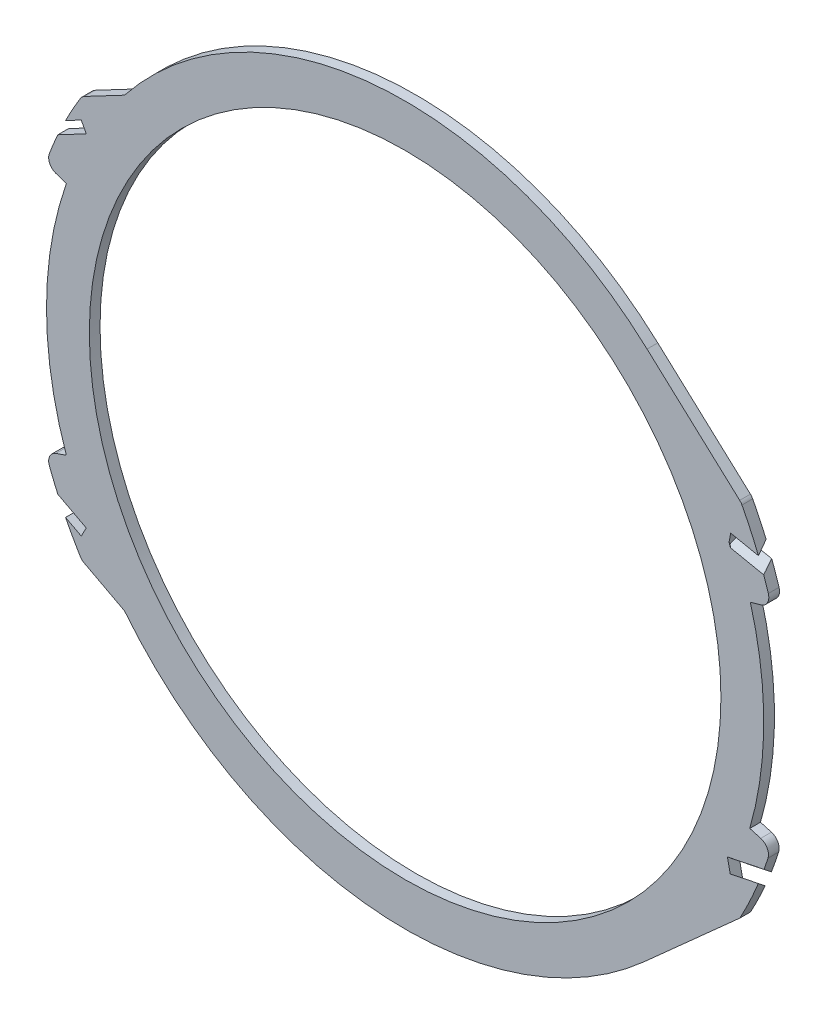
from build123d import *

# Parameters (mm, degrees)
SKETCH1_R            = 335
SKETCH1_R_2          = 295
BOSS_EXTRUDE1_DEPTH  = 10
BOSS_EXTRUDE2_DEPTH  = 10
BOSS_EXTRUDE3_DEPTH  = 10
CUT_EXTRUDE1_DEPTH   = 10
CUT_EXTRUDE2_START   = 272.424930167
CUT_EXTRUDE2_DEPTH   = 38.548591659
CUT_EXTRUDE2_START_2 = 161.824552733
CUT_EXTRUDE2_2_DEPTH = 10
BOSS_EXTRUDE4_DEPTH  = 10


with BuildPart() as part:
    # Sketch1 → Boss-Extrude1 (new body)
    with BuildSketch(Plane.XY):
        Circle(SKETCH1_R)
        Circle(SKETCH1_R_2, mode=Mode.SUBTRACT)
    extrude(amount=BOSS_EXTRUDE1_DEPTH)

    # Sketch2 → Boss-Extrude2 (add)
    with BuildSketch(Plane(origin=(0, 0, 0), x_dir=(-1, 0, 0), z_dir=(0, 0, -1))):
        with BuildLine():
            ThreePointArc((-322.474278085, 90.748773952), (-285.195118694, 175.7519396), (-226.022138309, 247.263003691))
            Line((-226.022138309, 247.263003691), (-312.556910604, 168.161908985))
            ThreePointArc((-312.556910604, 168.161908985), (-313.727388299, 166.889496734), (-314.661210657, 165.434496124))
            ThreePointArc((-314.661210657, 165.434496124), (-328.310849458, 136.353350264), (-339.27949001, 106.158738023))
            ThreePointArc((-339.27949001, 106.158738023), (-338.523562212, 98.412053492), (-332.442347906, 93.553928275))
            Line((-332.442347906, 93.553928275), (-322.474278085, 90.748773952))
        make_face()
    extrude(amount=-BOSS_EXTRUDE2_DEPTH)

    # Sketch3 → Boss-Extrude3 (add)
    with BuildSketch(Plane(origin=(0, 0, 0), x_dir=(-1, 0, 0), z_dir=(0, 0, -1))):
        with BuildLine():
            Line((-289.450839465, -149.430532958), (-290.086949825, -136.323752762))
            Line((-290.086949825, -136.323752762), (-321.966145398, -92.535405211))
            Line((-321.966145398, -92.535405211), (-332.178557921, -95.470526635))
            ThreePointArc((-332.178557921, -95.470526635), (-338.234587628, -100.365745681), (-338.943329669, -108.120508737))
            ThreePointArc((-338.943329669, -108.120508737), (-327.253686464, -139.562351058), (-312.654741, -169.763476834))
            Line((-312.654741, -169.763476834), (-223.394344885, -249.639673677))
            Line((-223.394344885, -249.639673677), (-289.450839465, -149.430532958))
        make_face()
    extrude(amount=-BOSS_EXTRUDE3_DEPTH)

    # Sketch4 → Cut-Extrude1 (cut)
    with BuildSketch(Plane(origin=(23.906119202, -116.35832345, 93.20136559), x_dir=(0.9873859847265816, 0.12357681316719145, -0.0989832733999036), z_dir=(-0.15833166823323438, 0.7706481888305408, -0.6172782613106412))):
        Polygon((282.331330651, 83.607742228), (286.950805192, 120.032776555), (337.459038649, 113.627250716), (329.847523561, 53.609667359), (279.339290104, 60.015193198), align=None)
    extrude(amount=-CUT_EXTRUDE1_DEPTH, mode=Mode.SUBTRACT)

    # Cut-Extrude2: read off the stored shape, not the designer's step
    # Cut-Extrude2 outline → Cut-Extrude2 (cut)
    with BuildSketch(Plane(origin=(0, 0, 0), x_dir=(0.20124905404319107, 0.9795401054815064, 0), z_dir=(0.9795401054815065, -0.20124905404319107, 0)).offset(CUT_EXTRUDE2_START)):
        Polygon((202.006915017, 0), (195.824910476, 10), (184.068330185, 10), (190.250334726, 0), align=None)
    extrude(amount=CUT_EXTRUDE2_DEPTH, mode=Mode.SUBTRACT)

    # Cut-Extrude2 2 outline → Cut-Extrude2 2 (cut)
    with BuildSketch(Plane(origin=(0, 0, 0), x_dir=(0.9852397845422891, -0.14476117541924635, -0.09136065370990885), z_dir=(0.1711799256778192, 0.8331845496216821, 0.5258335661753164)).offset(CUT_EXTRUDE2_START_2)):
        with BuildLine():
            Line((280.153711914, 76.574004203), (278.423879054, 60.562054707))
            add(Edge.make_bspline(
                [(278.423879054, 60.562054707), (279.04318666, 59.849827211), (279.679221342, 59.165584066), (280.331358402, 58.511847756)],
                knots=[0.202262646, 0.202262646, 0.202262646, 0.202262646, 0.204525626, 0.204525626, 0.204525626, 0.204525626], degree=3))
            Line((280.331358402, 58.511847756), (282.258121917, 76.346656647))
            Line((282.258121917, 76.346656647), (282.436738997, 78))
            Line((282.436738997, 78), (280.307767758, 78))
            Line((280.307767758, 78), (280.153711914, 76.574004203))
        make_face()
    extrude(amount=CUT_EXTRUDE2_2_DEPTH, mode=Mode.SUBTRACT)

    # Sketch6 → Boss-Extrude4 (add)
    with BuildSketch(Plane(origin=(0, 0, 0), x_dir=(-1, 0, 0), z_dir=(0, 0, -1))):
        with BuildLine():
            Line((297.863422842, -159.420809844), (324.396421164, -145.420809844))
            ThreePointArc((324.396421164, -145.420809844), (328.498305309, -135.901116291), (332.320896217, -126.265877963))
            ThreePointArc((332.320896217, -126.265877963), (332.034149526, -118.483971626), (326.252641154, -113.267224475))
            Line((326.252641154, -113.267224475), (309.887866806, -107.585760677))
            Line((309.887866806, -107.585760677), (279.768360506, -168.96857635))
            Line((279.768360506, -168.96857635), (279.768360506, -180.275251772))
            Line((279.768360506, -180.275251772), (256.883838664, -211.365229457))
            Line((256.883838664, -211.365229457), (299.577700502, -188.838033003))
            ThreePointArc((299.577700502, -188.838033003), (301.757845667, -187.282127202), (303.446809055, -185.203358702))
            ThreePointArc((303.446809055, -185.203358702), (310.564518318, -173.00268773), (317.191935305, -160.528895148))
            Line((317.191935305, -160.528895148), (302.530089508, -168.265142618))
            Line((302.530089508, -168.265142618), (297.863422842, -159.420809844))
        make_face()
        with BuildLine():
            Line((324.396421164, 145.420809844), (297.863422842, 159.420809844))
            Line((297.863422842, 159.420809844), (302.530089508, 168.265142618))
            Line((302.530089508, 168.265142618), (317.191935305, 160.528895148))
            ThreePointArc((317.191935305, 160.528895148), (310.564518318, 173.00268773), (303.446809055, 185.203358702))
            ThreePointArc((303.446809055, 185.203358702), (301.757845667, 187.282127202), (299.577700502, 188.838033003))
            Line((299.577700502, 188.838033003), (256.883838664, 211.365229457))
            Line((256.883838664, 211.365229457), (279.768360506, 180.275251772))
            Line((279.768360506, 180.275251772), (279.768360506, 168.96857635))
            Line((279.768360506, 168.96857635), (309.887866806, 107.585760677))
            Line((309.887866806, 107.585760677), (326.252641154, 113.267224475))
            ThreePointArc((326.252641154, 113.267224475), (332.034149526, 118.483971626), (332.320896217, 126.265877963))
            ThreePointArc((332.320896217, 126.265877963), (328.498305309, 135.901116291), (324.396421164, 145.420809844))
        make_face()
    extrude(amount=-BOSS_EXTRUDE4_DEPTH)


solid = part.part
